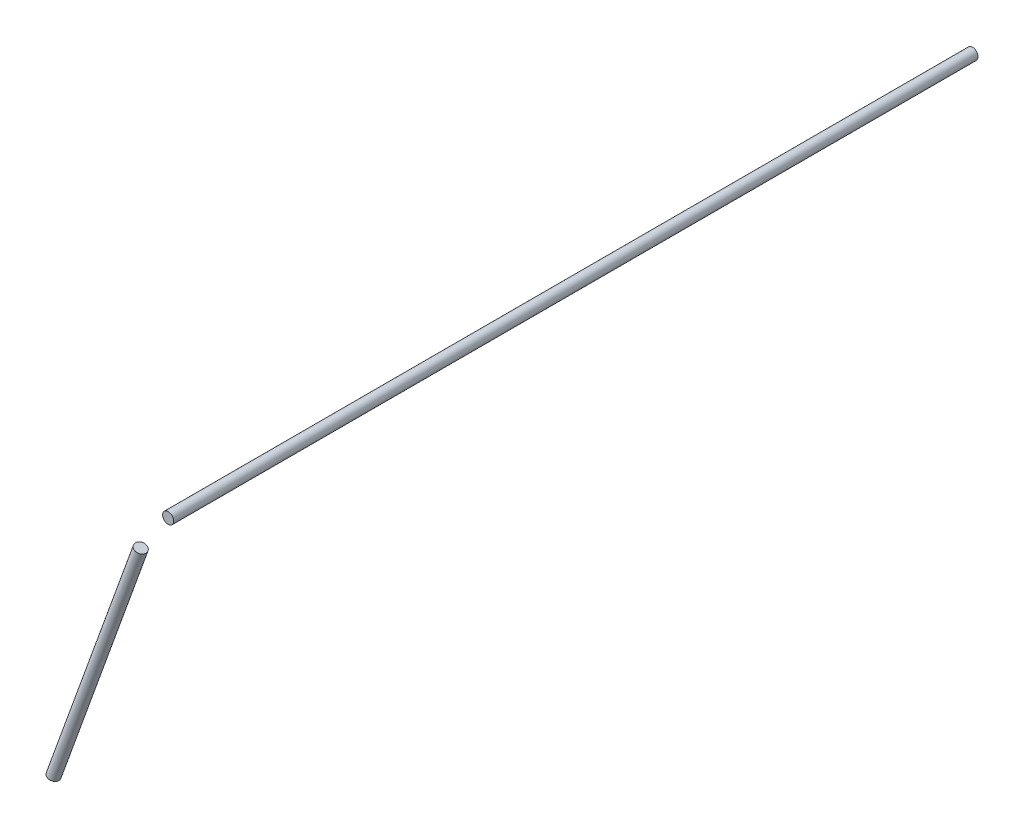
from build123d import *

# Parameters (mm, degrees)
BOSS_EXTRUDE1_START     = -459.716294764
BOSS_EXTRUDE1_OUTLINE_R = 3.175
BOSS_EXTRUDE1_DEPTH     = 459.716294764
SKETCH3_R               = 3.175
BOSS_EXTRUDE2_DEPTH     = 146.218301515


# Read off the part's stored shape, not the designer's step: Boss-Extrude1
with BuildPart() as part:
    # Boss-Extrude1 outline → Boss-Extrude1 (new body)
    with BuildSketch(Plane(origin=(0, 0, -15.24), x_dir=(-1, 0, 0), z_dir=(0, 0, -1)).offset(BOSS_EXTRUDE1_START)):
        Circle(BOSS_EXTRUDE1_OUTLINE_R)
    extrude(amount=BOSS_EXTRUDE1_DEPTH)


with BuildPart() as body_2:
    # Sketch3 → Boss-Extrude2 (new body)
    with BuildSketch(Plane(origin=(-3.978254652, -10.985870285, 0), x_dir=(0.9402490829575615, -0.3404873888963652, 0), z_dir=(0.3404873888963652, 0.9402490829575615, 4.8254138608759004e-15))):
        with Locations(Location((0, -456.160294764, 0), (0, 0, 180))):
            Circle(SKETCH3_R)
    extrude(amount=-BOSS_EXTRUDE2_DEPTH)


solid = Compound([part.part, body_2.part])
